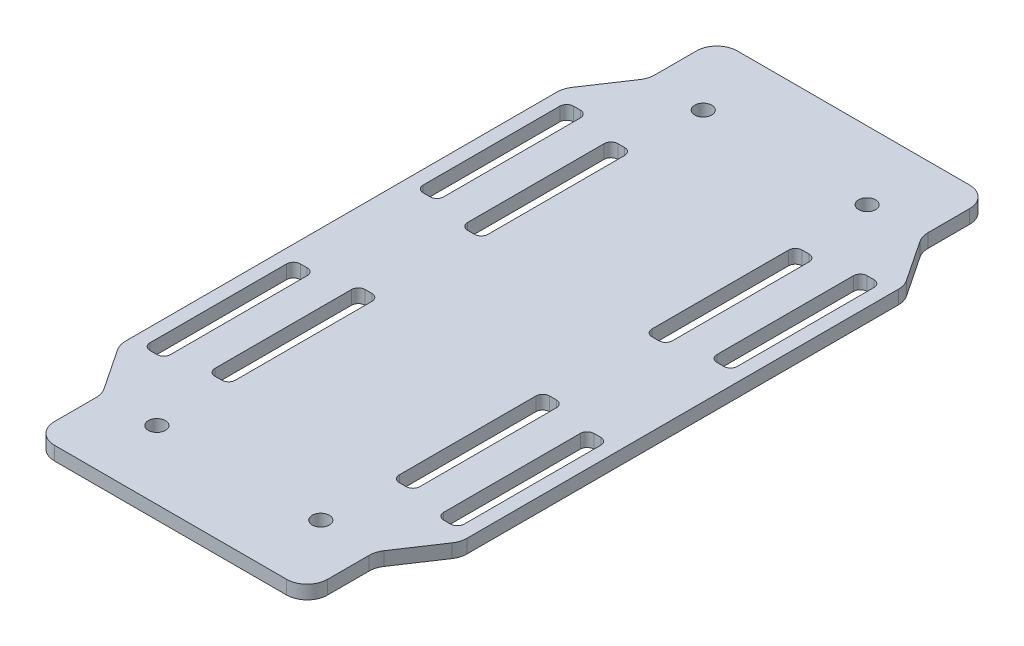
from build123d import *

# Parameters (mm, degrees)
BOSS_EXTRUDE1_DEPTH  = 2
FILLET1_R            = 3
CUT_EXTRUDE1_REACH   = 57.937
SKETCH2_R            = 1.25
SKETCH2_W            = 3
SKETCH2_H            = 22
FILLET2_R            = 1
FILLET2_OF_MIRROR1_R = 1
MIRROR2_OUTLINE_R    = 1.25
MIRROR2_DEPTH        = 2


# Read off the part's stored shape, not the designer's step: Mirror2
with BuildPart() as part:
    # Sketch1 → Boss-Extrude1 (new body)
    with BuildSketch(Plane(origin=(0, 0, 0), x_dir=(1, 0, 0), z_dir=(0, 1, 0))):
        Polygon((20, 50), (-20, 50), (-20, 40), (-25, 32.5), (-25, -32.5), (-20, -40), (-20, -50), (20, -50), (20, -40), (25, -32.5), (25, 32.5), (20, 40), align=None)
    extrude(amount=BOSS_EXTRUDE1_DEPTH)

    # Fillet1
    fillet1_edges = [part.edges().sort_by_distance(p)[0] for p in [
        (-20, 1, -50),
        (20, 1, -50),
        (20, 1, -40),
        (25, 1, -32.5),
        (25, 1, 32.5),
        (20, 1, 40),
        (20, 1, 50),
        (-20, 1, 50),
        (-20, 1, 40),
        (-25, 1, 32.5),
        (-25, 1, -32.5),
        (-20, 1, -40),
    ]]
    fillet(fillet1_edges, radius=FILLET1_R)

    # Sketch2 → Cut-Extrude1 (cut, up to next)
    with BuildSketch(Plane(origin=(0, 2, 0), x_dir=(1, 0, 0), z_dir=(0, 1, 0)), mode=Mode.PRIVATE) as cut_extrude1_sk1:
        with Locations(Location((12, 40, 0), (0, 0, 270))):
            Circle(SKETCH2_R)
    cut_extrude1_tool1 = extrude(cut_extrude1_sk1.sketch, amount=-CUT_EXTRUDE1_REACH, mode=Mode.PRIVATE) & part.part
    # Sketch2 → Cut-Extrude1 (cut, up to next)
    with BuildSketch(Plane(origin=(0, 2, 0), x_dir=(1, 0, 0), z_dir=(0, 1, 0)), mode=Mode.PRIVATE) as cut_extrude1_sk2:
        with Locations((21.5, 20)):
            Rectangle(SKETCH2_W, SKETCH2_H)
    cut_extrude1_tool2 = extrude(cut_extrude1_sk2.sketch, amount=-CUT_EXTRUDE1_REACH, mode=Mode.PRIVATE) & part.part
    # Sketch2 → Cut-Extrude1 (cut, up to next)
    with BuildSketch(Plane(origin=(0, 2, 0), x_dir=(1, 0, 0), z_dir=(0, 1, 0)), mode=Mode.PRIVATE) as cut_extrude1_sk3:
        with Locations((13.5, 18.5)):
            Rectangle(SKETCH2_W, SKETCH2_H)
    cut_extrude1_tool3 = extrude(cut_extrude1_sk3.sketch, amount=-CUT_EXTRUDE1_REACH, mode=Mode.PRIVATE) & part.part
    cut_extrude1_1 = cut_extrude1_tool1.solids().sort_by_distance((12, 2, -40))[0]
    add(cut_extrude1_1, mode=Mode.SUBTRACT)
    cut_extrude1_2 = cut_extrude1_tool2.solids().sort_by_distance((21.5, 2, -20))[0]
    add(cut_extrude1_2, mode=Mode.SUBTRACT)
    cut_extrude1_3 = cut_extrude1_tool3.solids().sort_by_distance((13.5, 2, -18.5))[0]
    add(cut_extrude1_3, mode=Mode.SUBTRACT)
    cut_extrude1 = cut_extrude1_1 + cut_extrude1_2 + cut_extrude1_3  # Cut-Extrude1 as one shape, for the pattern or mirror that repeats it

    # Fillet2
    fillet2_edges = [part.edges().sort_by_distance(p)[0] for p in [
        (20, 1, -9),
        (20, 1, -31),
        (23, 1, -31),
        (23, 1, -9),
        (15, 1, -29.5),
        (15, 1, -7.5),
        (12, 1, -7.5),
        (12, 1, -29.5),
    ]]
    fillet(fillet2_edges, radius=FILLET2_R)

    # Mirror1: Cut-Extrude1 across plane
    add(cut_extrude1.mirror(Plane.XY), mode=Mode.SUBTRACT)

    # Fillet2 of Mirror1
    fillet2_of_mirror1_edges = [part.edges().sort_by_distance(p)[0] for p in [
        (20, 1, 9),
        (20, 1, 31),
        (23, 1, 31),
        (23, 1, 9),
        (15, 1, 29.5),
        (15, 1, 7.5),
        (12, 1, 7.5),
        (12, 1, 29.5),
    ]]
    fillet(fillet2_of_mirror1_edges, radius=FILLET2_OF_MIRROR1_R)

    # Mirror2 outline → Mirror2 (cut)
    with BuildSketch(Plane(origin=(0, 0, 0), x_dir=(1, 0, 0), z_dir=(0, 1, 0))):
        with BuildLine():
            Line((-20, 10), (-20, 30))
            ThreePointArc((-20, 30), (-20.292893219, 30.707106781), (-21, 31))
            Line((-21, 31), (-22, 31))
            ThreePointArc((-22, 31), (-22.707106781, 30.707106781), (-23, 30))
            Line((-23, 30), (-23, 10))
            ThreePointArc((-23, 10), (-22.707106781, 9.292893219), (-22, 9))
            Line((-22, 9), (-21, 9))
            ThreePointArc((-21, 9), (-20.292893219, 9.292893219), (-20, 10))
        make_face()
        with BuildLine():
            ThreePointArc((-21, -31), (-20.292893219, -30.707106781), (-20, -30))
            Line((-20, -30), (-20, -10))
            ThreePointArc((-20, -10), (-20.292893219, -9.292893219), (-21, -9))
            Line((-21, -9), (-22, -9))
            ThreePointArc((-22, -9), (-22.707106781, -9.292893219), (-23, -10))
            Line((-23, -10), (-23, -30))
            ThreePointArc((-23, -30), (-22.707106781, -30.707106781), (-22, -31))
            Line((-22, -31), (-21, -31))
        make_face()
        with BuildLine():
            Line((-14, 7.5), (-13, 7.5))
            ThreePointArc((-13, 7.5), (-12.292893219, 7.792893219), (-12, 8.5))
            Line((-12, 8.5), (-12, 28.5))
            ThreePointArc((-12, 28.5), (-12.292893219, 29.207106781), (-13, 29.5))
            Line((-13, 29.5), (-14, 29.5))
            ThreePointArc((-14, 29.5), (-14.707106781, 29.207106781), (-15, 28.5))
            Line((-15, 28.5), (-15, 8.5))
            ThreePointArc((-15, 8.5), (-14.707106781, 7.792893219), (-14, 7.5))
        make_face()
        with BuildLine():
            ThreePointArc((-15, -28.5), (-14.707106781, -29.207106781), (-14, -29.5))
            Line((-14, -29.5), (-13, -29.5))
            ThreePointArc((-13, -29.5), (-12.292893219, -29.207106781), (-12, -28.5))
            Line((-12, -28.5), (-12, -8.5))
            ThreePointArc((-12, -8.5), (-12.292893219, -7.792893219), (-13, -7.5))
            Line((-13, -7.5), (-14, -7.5))
            ThreePointArc((-14, -7.5), (-14.707106781, -7.792893219), (-15, -8.5))
            Line((-15, -8.5), (-15, -28.5))
        make_face()
        with Locations((-12, 40)):
            Circle(MIRROR2_OUTLINE_R)
        with Locations((-12, -40)):
            Circle(MIRROR2_OUTLINE_R)
    extrude(amount=MIRROR2_DEPTH, mode=Mode.SUBTRACT)


solid = part.part
